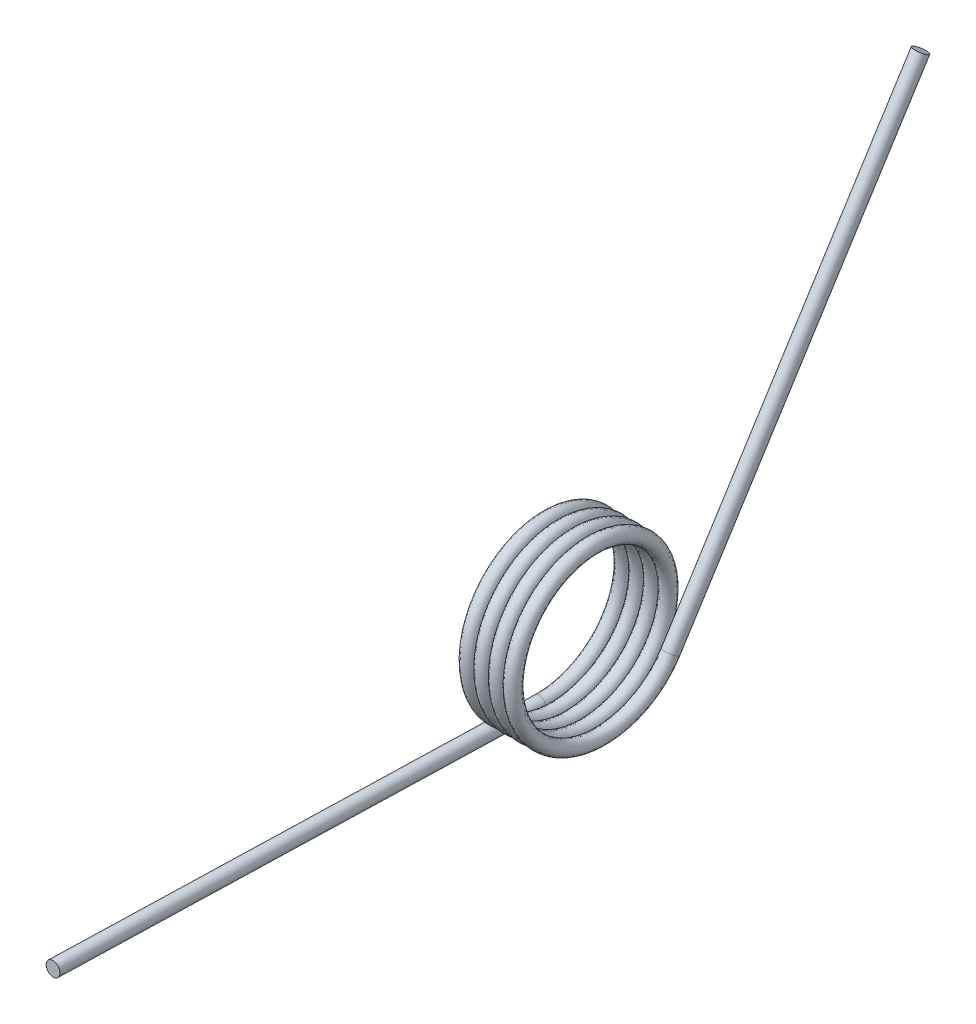
from build123d import *

# Parameters (mm, degrees)
SWEEP1_PITCH   = 0.7874
SKETCH4_R      = 0.381
EXTRUDE1_DEPTH = 25.4
SKETCH5_R      = 0.381
EXTRUDE2_DEPTH = 25.4


with BuildPart() as part:
    # Sweep1: arcs per turn and ends read off the stored shape
    # Sweep1: the profile of Sketch3 screwed along a right-hand helix through 4.166667 turns, 6 arcs to a turn; built about Z, then put on its axis
    sweep1_z = Axis((0, 0, 0), (0, 0, 1))
    sweep1_corners = [(4.364952965, -0.01095332, 0.380739609), (4.736997132, 0.000254581, -0.008849304), (4.347247035, 0.01095332, -0.380739609), (3.975202868, -0.000254581, 0.008849304)]
    with BuildLine(mode=Mode.PRIVATE) as sweep1_profile:
        ThreePointArc((4.364952965, -0.01095332, 0.380739609), (4.631694937, -0.00756515, 0.262966156), (4.736997132, 0.000254581, -0.008849304))
        ThreePointArc((4.736997132, 0.000254581, -0.008849304), (4.619174953, 0.007925183, -0.275480962), (4.347247035, 0.01095332, -0.380739609))
        ThreePointArc((4.347247035, 0.01095332, -0.380739609), (4.080505063, 0.00756515, -0.262966156), (3.975202868, -0.000254581, 0.008849304))
        ThreePointArc((3.975202868, -0.000254581, 0.008849304), (4.093025047, -0.007925183, 0.275480962), (4.364952965, -0.01095332, 0.380739609))
    sweep1_cap = Face(sweep1_profile.wire())
    sweep1_arcs = [((4.364952965, -0.01095332, 0.380739609), (4.745850097, -0.010698738, 0.371890305), (4.736997132, 0.000254581, -0.008849304), (1, 0.7071067811865476, 1)), ((4.736997132, 0.000254581, -0.008849304), (4.728144167, 0.011207901, -0.389588913), (4.347247035, 0.01095332, -0.380739609), (1, 0.7071067811865476, 1)), ((4.347247035, 0.01095332, -0.380739609), (3.966349903, 0.010698738, -0.371890305), (3.975202868, -0.000254581, 0.008849304), (1, 0.7071067811865476, 1)), ((3.975202868, -0.000254581, 0.008849304), (3.984055833, -0.011207901, 0.389588913), (4.364952965, -0.01095332, 0.380739609), (1, 0.7071067811865476, 1))]  # start, shoulder, end, weights
    sweep1_turn_angles = [0, 30, 60, 90, 120, 150, 180, 210, 240, 270, 300, 330, 360]
    sweep1_turn_weights = [1, 0.8660254037844387, 1, 0.8660254037844387, 1, 0.8660254037844387, 1, 0.8660254037844387, 1, 0.8660254037844387, 1, 0.8660254037844387, 1]
    sweep1_turn_sides = [Face.make_bezier_surface([[Vector(p[j][0], p[j][1], 0).rotate(sweep1_z, sweep1_turn_angles[2 * i + k]) / sweep1_turn_weights[2 * i + k] + Vector(0, 0, p[j][2] + SWEEP1_PITCH * sweep1_turn_angles[2 * i + k] / 360) for k in range(3)] for j in range(3)], [[p[3][j] * sweep1_turn_weights[2 * i + k] for k in range(3)] for j in range(3)]) for p in sweep1_arcs for i in range(6)]
    sweep1_last_angles = [1440, 1470, 1500]
    sweep1_last_weights = [1, 0.8660254037844208, 1]
    sweep1_last_sides = [Face.make_bezier_surface([[Vector(p[j][0], p[j][1], 0).rotate(sweep1_z, sweep1_last_angles[2 * i + k]) / sweep1_last_weights[2 * i + k] + Vector(0, 0, p[j][2] + SWEEP1_PITCH * sweep1_last_angles[2 * i + k] / 360) for k in range(3)] for j in range(3)], [[p[3][j] * sweep1_last_weights[2 * i + k] for k in range(3)] for j in range(3)]) for p in sweep1_arcs for i in range(1)]
    sweep1 = Plane(origin=(0, 0, 0), x_dir=(0, -1, 0), z_dir=(1, 0, 0)) * Solid(Shell([*[p.moved(Location((0, 0, SWEEP1_PITCH * i))) for i in range(4) for p in sweep1_turn_sides], *sweep1_last_sides, sweep1_cap, sweep1_cap.rotate(sweep1_z, 1500).moved(Location((0, 0, SWEEP1_PITCH * 1500 / 360)))]))
    add(sweep1)

    # Sketch4 → Extrude1 (add)
    with BuildSketch(Plane(origin=(0, 0, 0), x_dir=(-0.9993165588321744, 0.02323612909274854, -0.028748870388357876), z_dir=(-0.028756634544423613, -1.0606207752339447e-14, 0.999586442469924))):
        with Locations(Location((-0.101218902, 4.354923873, 0), (0, 0, 1.33145196))):
            Circle(SKETCH4_R)
    extrude(amount=EXTRUDE1_DEPTH)

    # Sketch5 → Extrude2 (add)
    with BuildSketch(Plane(origin=(0.002713066, 0.081672005, -0.047153354), x_dir=(0.9986645765534488, -0.046349846867163466, -0.022820062066337028), z_dir=(0.028756634544423607, 0.8656672524575099, -0.49979322123488695))):
        with Locations(Location((3.463492846, 4.211269495, 0), (0, 0, 177.539095764))):
            Circle(SKETCH5_R)
    extrude(amount=EXTRUDE2_DEPTH)


solid = part.part
